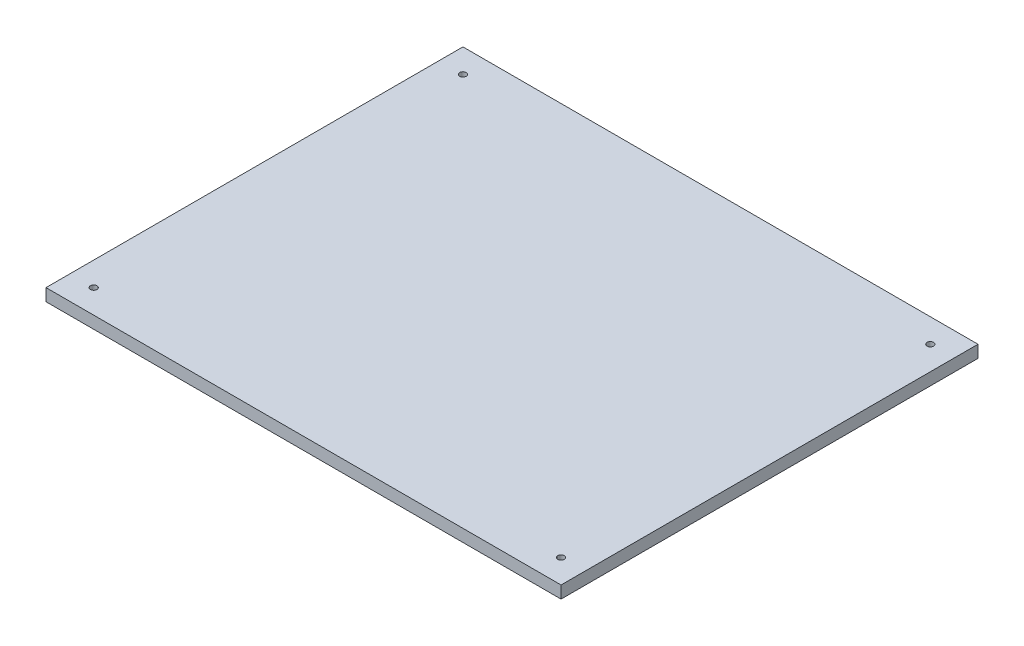
from build123d import *

# Parameters (mm, degrees)
SKETCH1_W            = 266.7
SKETCH1_H            = 215.9
BOSS_EXTRUDE1_DEPTH  = 6.35
M3_CLEARANCE_HOLE1_D = 3.4


with BuildPart() as part:
    # Sketch1 → Boss-Extrude1 (new body)
    with BuildSketch(Plane(origin=(0, 0, 0), x_dir=(1, 0, 0), z_dir=(0, 1, 0))):
        Rectangle(SKETCH1_W, SKETCH1_H)
    extrude(amount=BOSS_EXTRUDE1_DEPTH)

    # M3 Clearance Hole1 (through all)
    with Locations(Plane(origin=(0, 6.35, 0), x_dir=(1, 0, 0), z_dir=(0, 1, 0))):
        with Locations((121.0056, -95.6056), (-121.0056, -95.6056), (-121.0056, 95.6056), (121.0056, 95.6056)):
            Hole(M3_CLEARANCE_HOLE1_D / 2)


solid = part.part
